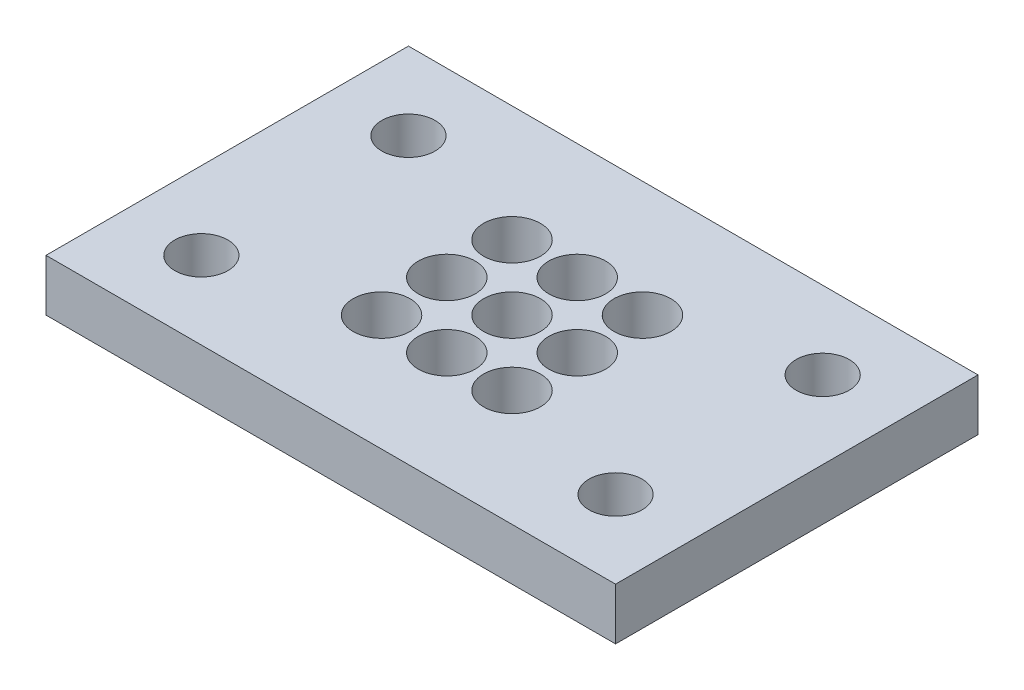
from build123d import *

# Parameters (mm, degrees)
SKETCH1_W           = 69.85
SKETCH1_H           = 44.45
SKETCH1_R           = 3.2639
SKETCH1_R_2         = 3.4925
BOSS_EXTRUDE1_DEPTH = 6.35


with BuildPart() as part:
    # Sketch1 → Boss-Extrude1 (new body)
    with BuildSketch(Plane(origin=(0, 0, 0), x_dir=(1, 0, 0), z_dir=(0, 1, 0))):
        with Locations((34.925, 22.225)):
            Rectangle(SKETCH1_W, SKETCH1_H)
        with Locations((9.525, 9.525)):
            Circle(SKETCH1_R, mode=Mode.SUBTRACT)
        with Locations((26.925, 14.225)):
            Circle(SKETCH1_R_2, mode=Mode.SUBTRACT)
        with Locations((26.925, 22.225)):
            Circle(SKETCH1_R_2, mode=Mode.SUBTRACT)
        with Locations((60.325, 9.525)):
            Circle(SKETCH1_R, mode=Mode.SUBTRACT)
        with Locations((34.925, 14.225)):
            Circle(SKETCH1_R_2, mode=Mode.SUBTRACT)
        with Locations((42.925, 14.225)):
            Circle(SKETCH1_R_2, mode=Mode.SUBTRACT)
        with Locations((26.925, 30.225)):
            Circle(SKETCH1_R_2, mode=Mode.SUBTRACT)
        with Locations((34.925, 30.225)):
            Circle(SKETCH1_R_2, mode=Mode.SUBTRACT)
        with Locations((9.525, 34.925)):
            Circle(SKETCH1_R, mode=Mode.SUBTRACT)
        with Locations((34.925, 22.225)):
            Circle(SKETCH1_R_2, mode=Mode.SUBTRACT)
        with Locations((42.925, 22.225)):
            Circle(SKETCH1_R_2, mode=Mode.SUBTRACT)
        with Locations((42.925, 30.225)):
            Circle(SKETCH1_R_2, mode=Mode.SUBTRACT)
        with Locations((60.325, 34.925)):
            Circle(SKETCH1_R, mode=Mode.SUBTRACT)
    extrude(amount=BOSS_EXTRUDE1_DEPTH)


solid = part.part
